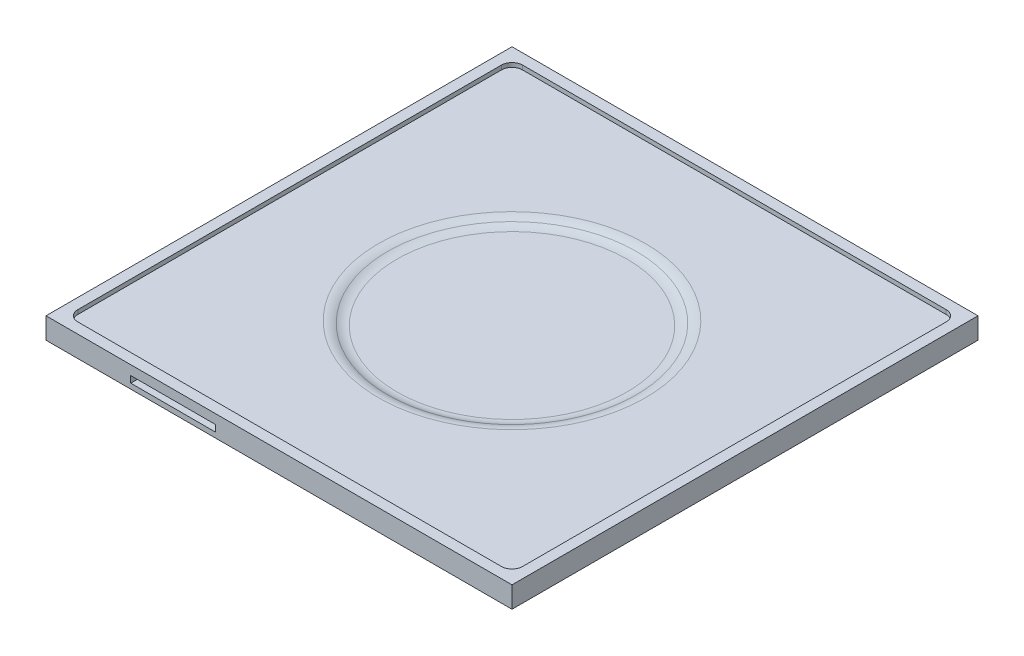
from build123d import *

# Parameters (mm, degrees)
SKETCH1_W           = 220
SKETCH1_H           = 220
BOSS_EXTRUDE1_DEPTH = 10
SKETCH2_W           = 210
SKETCH2_H           = 210
CUT_EXTRUDE1_DEPTH  = 2
SKETCH3_R           = 60.325
CUT_EXTRUDE2_DEPTH  = 2
FILLET1_R           = 10
FILLET2_R           = 10
FILLET3_R           = 5
FILLET4_R           = 5
FILLET5_R           = 5
FILLET6_R           = 5
SKETCH4_W           = 40
SKETCH4_H           = 3.1
CUT_EXTRUDE3_DEPTH  = 20


with BuildPart() as part:
    # Sketch1 → Boss-Extrude1 (new body)
    with BuildSketch(Plane(origin=(0, 0, 0), x_dir=(1, 0, 0), z_dir=(0, 1, 0))):
        Rectangle(SKETCH1_W, SKETCH1_H)
    extrude(amount=BOSS_EXTRUDE1_DEPTH)

    # Sketch2 → Cut-Extrude1 (cut)
    with BuildSketch(Plane(origin=(0, 10, 0), x_dir=(1, 0, 0), z_dir=(0, 1, 0))):
        Rectangle(SKETCH2_W, SKETCH2_H)
    extrude(amount=-CUT_EXTRUDE1_DEPTH, mode=Mode.SUBTRACT)

    # Sketch3 → Cut-Extrude2 (cut)
    with BuildSketch(Plane(origin=(0, 8, 0), x_dir=(1, 0, 0), z_dir=(0, 1, 0))):
        with Locations(Location((0, 0, 0), (0, 0, 270))):
            Circle(SKETCH3_R)
    extrude(amount=-CUT_EXTRUDE2_DEPTH, mode=Mode.SUBTRACT)

    # Fillet1
    # the kernel refuses this fillet: 10 mm, written as the material it adds along each edge
    with BuildSketch(Plane(origin=(0, 6, 0), x_dir=(0, 0, 1), z_dir=(-1, 0, 0))) as fillet1_piece_1:
        with BuildLine():
            CenterArc((54.325, 10), FILLET1_R, 270, 36.869897646)
            Line((54.325, 0), (54.325, -0.2))
            Line((54.325, -0.2), (60.325, -0.2))
            Line((60.325, -0.2), (60.525, 0))
            ThreePointArc((60.525, 0), (60.525, 1), (60.445, 1.84))
            Line((60.445, 1.84), (60.325, 2))
        make_face()
    revolve(axis=Axis((0, 6, 0), (0, 1, 0)))

    # Fillet2
    fillet2_edges = [part.edges().sort_by_distance(p)[0] for p in [
        (0, 8, -60.325),
    ]]
    fillet(fillet2_edges, radius=FILLET2_R)

    # Fillet3
    fillet3_edges = [part.edges().sort_by_distance(p)[0] for p in [
        (-105, 9, -105),
    ]]
    fillet(fillet3_edges, radius=FILLET3_R)

    # Fillet4
    fillet4_edges = [part.edges().sort_by_distance(p)[0] for p in [
        (105, 9, -105),
    ]]
    fillet(fillet4_edges, radius=FILLET4_R)

    # Fillet5
    fillet5_edges = [part.edges().sort_by_distance(p)[0] for p in [
        (-105, 9, 105),
    ]]
    fillet(fillet5_edges, radius=FILLET5_R)

    # Fillet6
    fillet6_edges = [part.edges().sort_by_distance(p)[0] for p in [
        (105, 9, 105),
    ]]
    fillet(fillet6_edges, radius=FILLET6_R)

    # Sketch4 → Cut-Extrude3 (cut)
    with BuildSketch(Plane.XY.offset(110)):
        with Locations((-50, 4)):
            Rectangle(SKETCH4_W, SKETCH4_H)
    extrude(amount=-CUT_EXTRUDE3_DEPTH, mode=Mode.SUBTRACT)


solid = part.part
